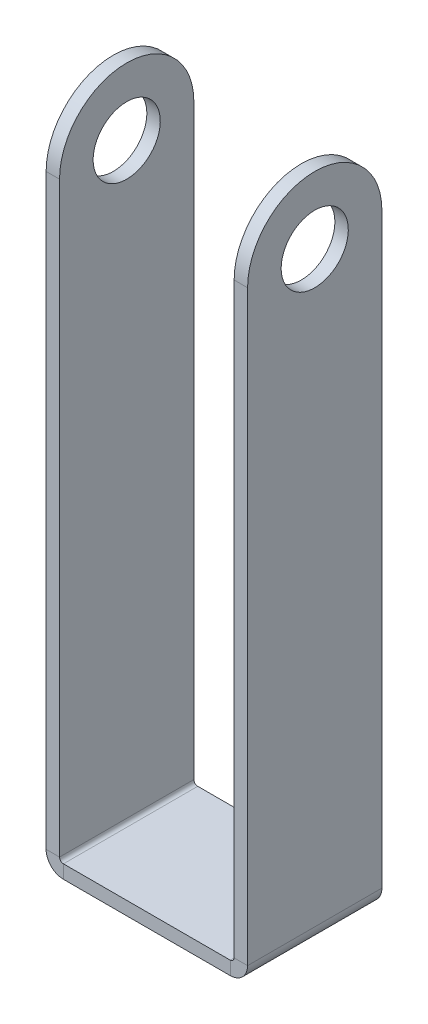
from build123d import *

# Parameters (mm, degrees)
SKETCH2_W                      = 38.1
SKETCH2_H                      = 25.4
BASE_FLANGE1_DEPTH             = 2.54
EDGE_FLANGE1_STRIP_W           = 11.6332
EDGE_FLANGE1_STRIP_H           = 2.54
EDGE_FLANGE1_STRIP_CUT_DEPTH   = 25.4
EDGE_FLANGE1_STRIP_2_W         = 11.6332
EDGE_FLANGE1_STRIP_2_H         = 2.54
EDGE_FLANGE1_STRIP_CUT_2_DEPTH = 25.4
EDGE_FLANGE1_DEPTH             = 25.4
EDGE_FLANGE1_BEND_DEPTH        = 25.4
CUT_EXTRUDE1_DEPTH             = 131.779171124
SKETCH14_R                     = 6.35
CUT_EXTRUDE2_DEPTH             = 131.779171124


# Sheet-metal steps are written as plain solids
with BuildPart() as part:
    # Sketch2 → Base-Flange1 (new body)
    with BuildSketch(Plane(origin=(0, 0, 0), x_dir=(1, 0, 0), z_dir=(0, 1, 0))):
        Rectangle(SKETCH2_W, SKETCH2_H)
    extrude(amount=-BASE_FLANGE1_DEPTH)

    # Edge-Flange1 strip (across the edge) → Edge-Flange1 strip cut (cut)
    with BuildSketch(Plane(origin=(19.05, 0, 12.7), x_dir=(-1, 0, 0), z_dir=(0, 0, -1))):
        with Locations((-2.54, -1.27)):
            Rectangle(EDGE_FLANGE1_STRIP_W, EDGE_FLANGE1_STRIP_H)
    extrude(amount=EDGE_FLANGE1_STRIP_CUT_DEPTH, mode=Mode.SUBTRACT)

    # Edge-Flange1 strip 2 (across the edge) → Edge-Flange1 strip cut 2 (cut)
    with BuildSketch(Plane(origin=(-19.05, 0, -12.7), x_dir=(1, 0, 0), z_dir=(0, 0, 1))):
        with Locations((-2.54, -1.27)):
            Rectangle(EDGE_FLANGE1_STRIP_2_W, EDGE_FLANGE1_STRIP_2_H)
    extrude(amount=EDGE_FLANGE1_STRIP_CUT_2_DEPTH, mode=Mode.SUBTRACT)

    # Edge-Flange1 section (across the edge) → Edge-Flange1 (add)
    with BuildSketch(Plane(origin=(19.05, 0, 12.7), x_dir=(-1, 0, 0), z_dir=(0, 0, -1))):
        with BuildLine():
            Line((0, 0.7366), (0, 124.46))
            Line((0, 124.46), (2.54, 124.46))
            Line((2.54, 124.46), (2.54, 0.7366))
            ThreePointArc((2.54, 0.7366), (2.755745145, 0.215745145), (3.2766, 0))
            Line((3.2766, 0), (3.2766, -2.54))
            ThreePointArc((3.2766, -2.54), (0.959693921, -1.580306079), (0, 0.7366))
        make_face()
    extrude(amount=EDGE_FLANGE1_DEPTH)

    # Edge-Flange1 section 2 (across the edge) → Edge-Flange1 bend (add)
    with BuildSketch(Plane(origin=(-19.05, 0, -12.7), x_dir=(1, 0, 0), z_dir=(0, 0, 1))):
        with BuildLine():
            Line((0, 0.7366), (0, 124.46))
            Line((0, 124.46), (2.54, 124.46))
            Line((2.54, 124.46), (2.54, 0.7366))
            ThreePointArc((2.54, 0.7366), (2.755745145, 0.215745145), (3.2766, 0))
            Line((3.2766, 0), (3.2766, -2.54))
            ThreePointArc((3.2766, -2.54), (0.959693921, -1.580306079), (0, 0.7366))
        make_face()
    extrude(amount=EDGE_FLANGE1_BEND_DEPTH)

    # Sketch13 → Cut-Extrude1 (cut, through all)
    with BuildSketch(Plane(origin=(19.05, 0, 0), x_dir=(0, 0, -1), z_dir=(1, 0, 0))):
        with BuildLine():
            ThreePointArc((-2.4e-08, 124.46), (8.980256112, 120.74025613), (12.7, 111.76))
            Line((12.7, 111.76), (12.7, 124.46))
            Line((12.7, 124.46), (-2.4e-08, 124.46))
        make_face()
        with BuildLine():
            Line((-12.7, 124.46), (-12.7, 111.76))
            ThreePointArc((-12.7, 111.76), (-8.98025613, 120.740256112), (-2.4e-08, 124.46))
            Line((-2.4e-08, 124.46), (-12.7, 124.46))
        make_face()
    extrude(amount=-CUT_EXTRUDE1_DEPTH, mode=Mode.SUBTRACT)

    # Sketch14 → Cut-Extrude2 (cut, through all)
    with BuildSketch(Plane(origin=(19.05, 0, 0), x_dir=(0, 0, -1), z_dir=(1, 0, 0))):
        with Locations(Location((0, 111.76, 0), (0, 0, 90))):
            Circle(SKETCH14_R)
    extrude(amount=-CUT_EXTRUDE2_DEPTH, mode=Mode.SUBTRACT)


solid = part.part
